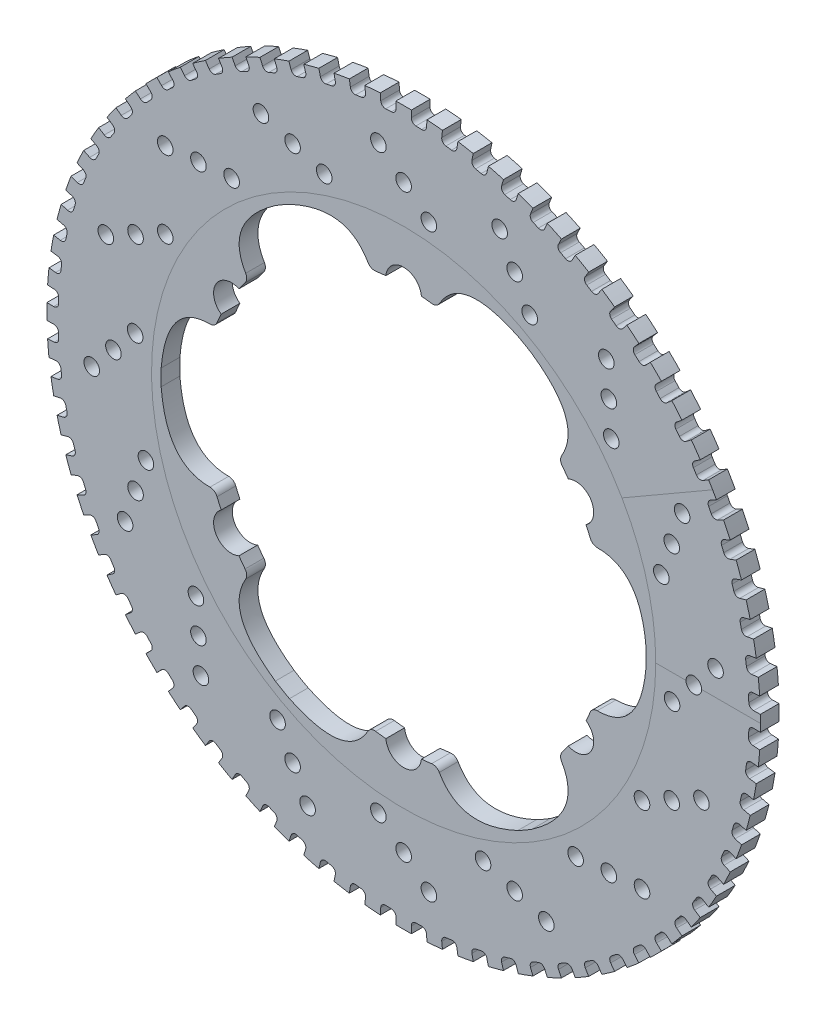
from build123d import *

# Parameters (mm, degrees)
SKETCH2_R                = 95.25
SKETCH2_R_2              = 64.77
ROTORSWEPT_DEPTH         = 5
FLOATPINIF_DEPTH         = 5
FLOATPINPATTERN_COUNT    = 6
SKETCH4_R                = 2.0828
HOLES_DEPTH              = 135.796606185
HOLESPATTERN_COUNT       = 16
TOOTHCUTOUT_DEPTH        = 135.796606185
TOOTHCUTOUTPATTERN_COUNT = 72
FILLET1_R                = 2.032


with BuildPart() as part:
    # Sketch2 → RotorSwept (new body)
    with BuildSketch(Plane.XY):
        Circle(SKETCH2_R)
        Circle(SKETCH2_R_2, mode=Mode.SUBTRACT)
    extrude(amount=ROTORSWEPT_DEPTH)

    # Sketch3 → FloatPinIF (add, through all)
    with BuildSketch(Plane.XY.offset(5)):
        with BuildLine():
            ThreePointArc((-4.743483699, 53.511168959), (0, 57.8485), (4.743483699, 53.511168959))
            ThreePointArc((4.743483699, 53.511168959), (6.821907433, 53.286090305), (8.89, 52.980314656))
            add(Edge.make_bspline(
                [(8.89, 52.980314656), (14.425343999, 64.673785156), (30.48, 57.15)],
                knots=[0, 0, 0, 1, 1, 1], degree=2))
            ThreePointArc((30.48, 57.15), (0, 64.77), (-30.48, 57.15))
            add(Edge.make_bspline(
                [(-8.89, 52.980314656), (-14.425343999, 64.673785156), (-30.48, 57.15)],
                knots=[0, 0, 0, 1, 1, 1], degree=2))
            ThreePointArc((-8.89, 52.980314656), (-6.821907433, 53.286090305), (-4.743483699, 53.511168959))
        make_face()
    floatpinif = extrude(amount=-FLOATPINIF_DEPTH)

    # FloatPinPattern: FloatPinIF ×6 about axis
    floatpinpattern_axis = Axis((0, 0, 5), (0, 0, -1))
    for i in range(1, FLOATPINPATTERN_COUNT):
        add(floatpinif.rotate(floatpinpattern_axis, i * 360 / FLOATPINPATTERN_COUNT))

    # Sketch4 → Holes (cut, through all)
    with BuildSketch(Plane.XY.offset(5)):
        with Locations((0, 77.47)):
            Circle(SKETCH4_R)
        with Locations((-6.740084385, 83.266840733)):
            Circle(SKETCH4_R)
        with Locations((6.740084385, 71.673159267)):
            Circle(SKETCH4_R)
    holes = extrude(amount=-HOLES_DEPTH, mode=Mode.SUBTRACT)

    # HolesPattern: Holes ×16 about axis
    holespattern_axis = Axis((0, 0, 0), (0, 0, 1))
    for i in range(1, HOLESPATTERN_COUNT):
        add(holes.rotate(holespattern_axis, i * 360 / HOLESPATTERN_COUNT), mode=Mode.SUBTRACT)

    # Sketch5 → ToothCutOut (cut, through all)
    with BuildSketch(Plane.XY.offset(5)):
        with BuildLine():
            Line((2.0778678, 95.227333079), (2.038892713, 93.441130133))
            ThreePointArc((2.038892713, 93.441130133), (2.385243109, 92.541456411), (3.263636812, 92.144221082))
            ThreePointArc((3.263636812, 92.144221082), (4.021794754, 92.114244126), (4.77968034, 92.078029192))
            ThreePointArc((4.77968034, 92.078029192), (5.689352829, 92.397195865), (6.11279699, 93.263259631))
            Line((6.11279699, 93.263259631), (6.229648059, 95.046062438))
            ThreePointArc((6.229648059, 95.046062438), (4.154746647, 95.159343106), (2.0778678, 95.227333079))
        make_face()
    toothcutout = extrude(amount=-TOOTHCUTOUT_DEPTH, mode=Mode.SUBTRACT)

    # ToothCutOutPattern: ToothCutOut ×72 about axis
    toothcutoutpattern_axis = Axis((0, 0, 0), (0, 0, 1))
    for i in range(1, TOOTHCUTOUTPATTERN_COUNT):
        add(toothcutout.rotate(toothcutoutpattern_axis, i * 360 / TOOTHCUTOUTPATTERN_COUNT), mode=Mode.SUBTRACT)

    # Fillet1
    fillet1_edges = [part.edges().sort_by_distance(p)[0] for p in [
        (-8.89, -52.980314656, 2.5),
        (8.89, -52.980314656, 2.5),
        (41.437298392, -34.189123167, 2.5),
        (50.327298392, -18.791191488, 2.5),
        (-50.327298392, -18.791191488, 2.5),
        (-41.437298392, -34.189123167, 2.5),
        (-41.437298392, 34.189123167, 2.5),
        (-50.327298392, 18.791191488, 2.5),
        (50.327298392, 18.791191488, 2.5),
        (41.437298392, 34.189123167, 2.5),
        (8.89, 52.980314656, 2.5),
        (-8.89, 52.980314656, 2.5),
    ]]
    fillet(fillet1_edges, radius=FILLET1_R)


solid = part.part
